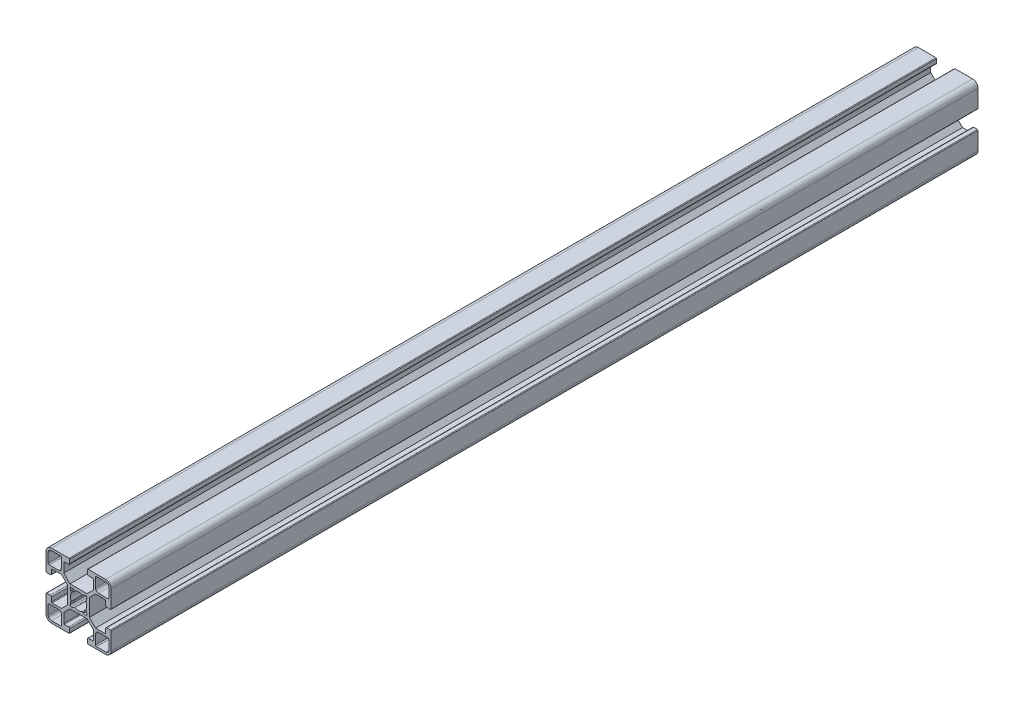
from build123d import *

# Parameters (mm, degrees)
BOSS_EXTRUDE1_DEPTH = 200


with BuildPart() as part:
    # Sketch1 → Boss-Extrude1 (new, symmetric)
    with BuildSketch(Plane.XY):
        with BuildLine():
            Line((21.799994, 7.139358412), (18.939339529, 9.999998412))
            Line((18.939339529, 9.999998412), (11.060658529, 9.999998412))
            Line((11.060658529, 9.999998412), (8.200003529, 7.139342412))
            Line((8.200003529, 7.139342412), (8.200003529, 2.800001412))
            ThreePointArc((8.200003529, 2.800001412), (8.287868495, 2.58786762), (8.500000529, 2.499998412))
            Line((8.500000529, 2.499998412), (10.400000529, 2.499998412))
            ThreePointArc((10.400000529, 2.499998412), (10.75355392, 2.353551802), (10.900000529, 1.999998412))
            Line((10.900000529, 1.999998412), (10.900000529, 0.299995529))
            ThreePointArc((10.900000529, 0.299995529), (10.812133796, 0.08786744), (10.600006, 0))
            Line((10.600006, 0), (2.5, 0))
            ThreePointArc((2.5, 0), (0.732233047, 0.732233047), (0, 2.5))
            Line((0, 2.5), (0, 10.600006))
            ThreePointArc((0, 10.600006), (0.087869562, 10.812137388), (0.300003, 10.900002))
            Line((0.300003, 10.900002), (2, 10.900002))
            ThreePointArc((2, 10.900002), (2.353553391, 10.753555391), (2.5, 10.400002))
            Line((2.5, 10.400002), (2.5, 8.500002))
            ThreePointArc((2.5, 8.500002), (2.587869099, 8.287870075), (2.80000269, 8.200005))
            Line((2.80000269, 8.200005), (7.139344, 8.200005))
            Line((7.139344, 8.200005), (10, 11.06066))
            Line((10, 11.06066), (10, 18.939341))
            Line((10, 18.939341), (7.139344, 21.799985148))
            Line((7.139344, 21.799985148), (2.800003, 21.799985148))
            ThreePointArc((2.800003, 21.799985148), (2.587872691, 21.712123666), (2.5, 21.499998))
            Line((2.5, 21.499998), (2.5, 19.599988398))
            ThreePointArc((2.5, 19.599988398), (2.353553317, 19.246434831), (1.99999975, 19.099988148))
            Line((1.99999975, 19.099988148), (0.299996735, 19.099988148))
            ThreePointArc((0.299996735, 19.099988148), (0.0878677, 19.187854622), (0, 19.399983148))
            Line((0, 19.399983148), (0, 27.499989148))
            ThreePointArc((0, 27.499989148), (0.732232787, 29.267756841), (2.500000265, 29.999990148))
            Line((2.500000265, 29.999990148), (10.6000062, 29.999990148))
            ThreePointArc((10.6000062, 29.999990148), (10.812133482, 29.912123021), (10.900000529, 29.699995706))
            Line((10.900000529, 29.699995706), (10.900000529, 27.999998706))
            ThreePointArc((10.900000529, 27.999998706), (10.753556384, 27.64644081), (10.400000529, 27.499991736))
            Line((10.400000529, 27.499991736), (8.499998529, 27.499991736))
            ThreePointArc((8.499998529, 27.499991736), (8.287867897, 27.41212193), (8.200003529, 27.199989046))
            Line((8.200003529, 27.199989046), (8.200003529, 22.860646736))
            Line((8.200003529, 22.860646736), (11.060659, 19.999991736))
            Line((11.060659, 19.999991736), (18.93934, 19.999991736))
            Line((18.93934, 19.999991736), (21.799994, 22.860646736))
            Line((21.799994, 22.860646736), (21.799994, 27.199988736))
            ThreePointArc((21.799994, 27.199988736), (21.712128868, 27.412122694), (21.499996529, 27.499991736))
            Line((21.499996529, 27.499991736), (19.599998, 27.499991736))
            ThreePointArc((19.599998, 27.499991736), (19.246444609, 27.646438346), (19.099998, 27.999991736))
            Line((19.099998, 27.999991736), (19.099998, 29.700007823))
            ThreePointArc((19.099998, 29.700007823), (19.187864526, 29.912137383), (19.3999935, 30.000005323))
            Line((19.3999935, 30.000005323), (27.4999995, 30.000005323))
            ThreePointArc((27.4999995, 30.000005323), (29.267773609, 29.267772326), (30.000009773, 27.499999529))
            Line((30.000009773, 27.499999529), (30.000009773, 19.399993594))
            ThreePointArc((30.000009773, 19.399993594), (29.912139919, 19.187852468), (29.6999965, 19.099988148))
            Line((29.6999965, 19.099988148), (27.9999995, 19.099988148))
            ThreePointArc((27.9999995, 19.099988148), (27.64645275, 19.246438389), (27.500009772, 19.599988147))
            Line((27.500009772, 19.599988147), (27.500009772, 21.499990147))
            ThreePointArc((27.500009772, 21.499990147), (27.412139967, 21.712120779), (27.200007083, 21.799985148))
            Line((27.200007083, 21.799985148), (22.860664773, 21.799985148))
            Line((22.860664773, 21.799985148), (20.000009773, 18.939341))
            Line((20.000009773, 18.939341), (20.000009773, 11.06066))
            Line((20.000009773, 11.06066), (22.8606545, 8.200005))
            Line((22.8606545, 8.200005), (27.1999965, 8.200005))
            ThreePointArc((27.1999965, 8.200005), (27.412129602, 8.287869277), (27.499999499, 8.500000052))
            Line((27.499999499, 8.500000052), (27.499999499, 10.400002001))
            ThreePointArc((27.499999499, 10.400002001), (27.646446109, 10.753555391), (27.9999995, 10.900002))
            Line((27.9999995, 10.900002), (29.7000025, 10.900002))
            ThreePointArc((29.7000025, 10.900002), (29.912138814, 10.812138492), (30.000009773, 10.600005265))
            Line((30.000009773, 10.600005265), (30.000009773, 2.499999265))
            ThreePointArc((30.000009773, 2.499999265), (29.267773942, 0.732224081), (27.500000177, -1.5175e-05))
            Line((27.500000177, -1.5175e-05), (19.399994245, -1.5175e-05))
            ThreePointArc((19.399994245, -1.5175e-05), (19.187855627, 0.08786137), (19.099998, 0.300007824))
            Line((19.099998, 0.300007824), (19.099998, 2.000004824))
            ThreePointArc((19.099998, 2.000004824), (19.246446356, 2.353553549), (19.599996529, 2.499998412))
            Line((19.599996529, 2.499998412), (21.499998529, 2.499998412))
            ThreePointArc((21.499998529, 2.499998412), (21.712135123, 2.587873708), (21.799994, 2.800017102))
            Line((21.799994, 2.800017102), (21.799994, 7.139358412))
        make_face()
        with BuildLine():
            Line((18.878868942, 11.714100014), (18.657285002, 12.75690673))
            Line((18.657285002, 12.75690673), (18.419345869, 12.994846743))
            ThreePointArc((18.419345869, 12.994846743), (18.335473622, 13.158180995), (18.362480424, 13.339793948))
            ThreePointArc((18.362480424, 13.339793948), (18.750006156, 14.99998656), (18.362487962, 16.660180933))
            ThreePointArc((18.362487962, 16.660180933), (18.335481889, 16.841794157), (18.419354758, 17.005128271))
            Line((18.419354758, 17.005128271), (18.657294593, 17.243067582))
            Line((18.657294593, 17.243067582), (18.878893628, 18.28587109))
            ThreePointArc((18.878893628, 18.28587109), (18.743367928, 18.743355263), (18.285883756, 18.878880962))
            Line((18.285883756, 18.878880962), (17.243080247, 18.657281928))
            Line((17.243080247, 18.657281928), (17.005140412, 18.419342617))
            ThreePointArc((17.005140412, 18.419342617), (16.84180664, 18.335470316), (16.660194009, 18.362476539))
            ThreePointArc((16.660194009, 18.362476539), (15.00000526, 18.749996344), (13.339816433, 18.362476869))
            ThreePointArc((13.339816433, 18.362476869), (13.158203164, 18.335470716), (12.994869031, 18.419343671))
            Line((12.994869031, 18.419343671), (12.756929898, 18.657283684))
            Line((12.756929898, 18.657283684), (11.714126233, 18.878881984))
            ThreePointArc((11.714126233, 18.878881984), (11.256641967, 18.743355772), (11.121116891, 18.28587117))
            Line((11.121116891, 18.28587117), (11.342717777, 17.243068055))
            Line((11.342717777, 17.243068055), (11.580656587, 17.00512772))
            ThreePointArc((11.580656587, 17.00512772), (11.664528478, 16.841794182), (11.637522309, 16.660181943))
            ThreePointArc((11.637522309, 16.660181943), (11.250003617, 14.999998075), (11.637519652, 13.339813587))
            ThreePointArc((11.637519652, 13.339813587), (11.664525497, 13.15820068), (11.580652734, 12.994866901))
            Line((11.580652734, 12.994866901), (11.342712898, 12.75692759))
            Line((11.342712898, 12.75692759), (11.12111194, 11.71412449))
            ThreePointArc((11.12111194, 11.71412449), (11.256636795, 11.256640068), (11.714120718, 11.121113524))
            Line((11.714120718, 11.121113524), (12.756924635, 11.342710635))
            Line((12.756924635, 11.342710635), (12.99486447, 11.580649946))
            ThreePointArc((12.99486447, 11.580649946), (13.158198441, 11.66452228), (13.339811235, 11.637515845))
            ThreePointArc((13.339811235, 11.637515845), (14.999988879, 11.249993804), (16.660169832, 11.637501672))
            ThreePointArc((16.660169832, 11.637501672), (16.841782614, 11.664506717), (17.005115943, 11.580633605))
            Line((17.005115943, 11.580633605), (17.243054753, 11.34269327))
            Line((17.243054753, 11.34269327), (18.285858839, 11.12109695))
            ThreePointArc((18.285858839, 11.12109695), (18.743339639, 11.256620822), (18.878868942, 11.714100014))
        make_face(mode=Mode.SUBTRACT)
        with BuildLine():
            Line((23.299995, 1), (27.5, 1))
            ThreePointArc((27.5, 1), (28.56065669, 1.439341852), (28.999994597, 2.500000176))
            Line((28.999994597, 2.500000176), (28.999994597, 6.700005176))
            ThreePointArc((28.999994597, 6.700005176), (28.853547926, 7.053558453), (28.499994597, 7.200005))
            Line((28.499994597, 7.200005), (24.299995, 7.200005))
            ThreePointArc((24.299995, 7.200005), (23.239334828, 6.760665172), (22.799995, 5.700005))
            Line((22.799995, 5.700005), (22.799995, 1.5))
            ThreePointArc((22.799995, 1.5), (22.946441609, 1.146446609), (23.299995, 1))
        make_face(mode=Mode.SUBTRACT)
        with BuildLine():
            Line((2.5, 1), (6.700005, 1))
            ThreePointArc((6.700005, 1), (7.05355839, 1.146446609), (7.200005, 1.5))
            Line((7.200005, 1.5), (7.200005, 5.700005))
            ThreePointArc((7.200005, 5.700005), (6.760665172, 6.760665172), (5.700005, 7.200005))
            Line((5.700005, 7.200005), (1.5, 7.200005))
            ThreePointArc((1.5, 7.200005), (1.146446609, 7.053558391), (1, 6.700005))
            Line((1, 6.700005), (1, 2.5))
            ThreePointArc((1, 2.5), (1.439339828, 1.439339828), (2.5, 1))
        make_face(mode=Mode.SUBTRACT)
        with BuildLine():
            Line((1.5, 22.799985148), (5.700005, 22.799985148))
            ThreePointArc((5.700005, 22.799985148), (6.760665172, 23.239324976), (7.200005, 24.299985148))
            Line((7.200005, 24.299985148), (7.200005, 28.499990148))
            ThreePointArc((7.200005, 28.499990148), (7.053558391, 28.853543539), (6.700005, 28.999990148))
            Line((6.700005, 28.999990148), (2.5, 28.999990148))
            ThreePointArc((2.5, 28.999990148), (1.439339828, 28.56065032), (1, 27.499990148))
            Line((1, 27.499990148), (1, 23.299985148))
            ThreePointArc((1, 23.299985148), (1.146446609, 22.946431757), (1.5, 22.799985148))
        make_face(mode=Mode.SUBTRACT)
        with BuildLine():
            Line((24.299995, 22.799985148), (28.499994597, 22.799985148))
            ThreePointArc((28.499994597, 22.799985148), (28.853551502, 22.946435272), (28.999994597, 23.299995088))
            Line((28.999994597, 23.299995088), (28.999994597, 27.500000088))
            ThreePointArc((28.999994597, 27.500000088), (28.560656076, 28.560654835), (27.5, 28.999990148))
            Line((27.5, 28.999990148), (23.299995, 28.999990148))
            ThreePointArc((23.299995, 28.999990148), (22.94644161, 28.853543539), (22.799995, 28.499990148))
            Line((22.799995, 28.499990148), (22.799995, 24.299985148))
            ThreePointArc((22.799995, 24.299985148), (23.239334828, 23.239324976), (24.299995, 22.799985148))
        make_face(mode=Mode.SUBTRACT)
    extrude(amount=BOSS_EXTRUDE1_DEPTH, both=True)


solid = part.part
